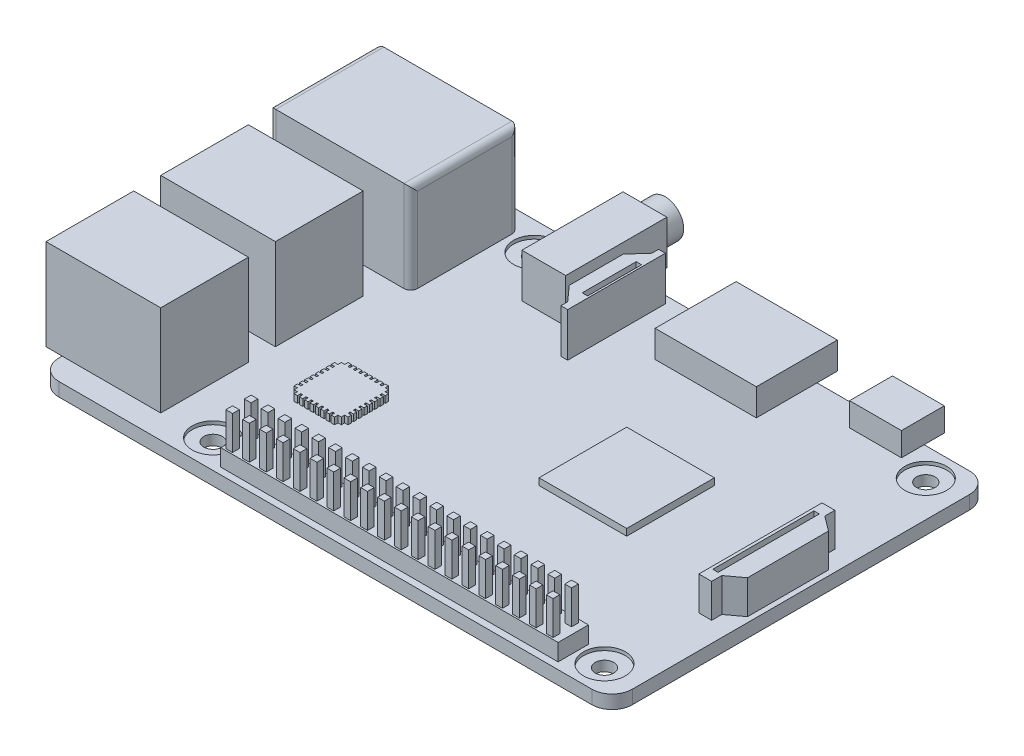
from build123d import *

# Parameters (mm, degrees)
SKETCH3_W            = 85
SKETCH3_H            = 56
BOSS_EXTRUDE1_DEPTH  = 2
FILLET1_R            = 3
SKETCH4_R            = 3.1
CUT_EXTRUDE1_DEPTH   = 0.5
SKETCH5_R            = 1.375
CUT_EXTRUDE2_DEPTH   = 51.933780539
SKETCH7_W            = 21
SKETCH7_H            = 16
BOSS_EXTRUDE2_DEPTH  = 13.5
FILLET2_R            = 1
CUT_EXTRUDE4_DEPTH   = 13.5
SKETCH9_W            = 17
SKETCH9_H            = 13
BOSS_EXTRUDE3_DEPTH  = 13.5
SKETCH10_W           = 10.6
SKETCH10_H           = 5
CUT_EXTRUDE5_DEPTH   = 13.5
SKETCH11_W           = 9.4
SKETCH11_H           = 0.8
BOSS_EXTRUDE4_DEPTH  = 13.5
LPATTERN2_COUNT      = 2
LPATTERN2_PITCH      = 17
SKETCH15_W           = 10.6
SKETCH15_H           = 5
CUT_EXTRUDE6_DEPTH   = 13.5
SKETCH16_W           = 9.4
SKETCH16_H           = 0.8
BOSS_EXTRUDE5_DEPTH  = 13.5
SKETCH18_W           = 50
SKETCH18_H           = 4.5
BOSS_EXTRUDE6_DEPTH  = 2.5
SKETCH19_W           = 1
SKETCH19_H           = 1
CUT_EXTRUDE7_DEPTH   = 2.5
LPATTERN4_COUNT      = 2
LPATTERN4_PITCH      = 2.75
SKETCH22_W           = 1
SKETCH22_H           = 1
BOSS_EXTRUDE7_DEPTH  = 7.5
LPATTERN5_COUNT      = 2
LPATTERN5_PITCH      = 2.75
SKETCH23_W           = 13
SKETCH23_H           = 13
BOSS_EXTRUDE8_DEPTH  = 1
SKETCH24_W           = 7
SKETCH24_H           = 7
BOSS_EXTRUDE9_DEPTH  = 1
BOSS_EXTRUDE10_DEPTH = 5
SKETCH26_W           = 0.8
SKETCH26_H           = 14.989562919
CUT_EXTRUDE8_DEPTH   = 5
SKETCH27_W           = 6.5
SKETCH27_H           = 14.991590698
BOSS_EXTRUDE11_DEPTH = 6.5
SKETCH28_R           = 2.75
BOSS_EXTRUDE12_DEPTH = 3
SKETCH29_R           = 1.5
CUT_EXTRUDE10_DEPTH  = 15
BOSS_EXTRUDE13_DEPTH = 6.5
SKETCH31_W           = 0.8
SKETCH31_H           = 8
CUT_EXTRUDE11_DEPTH  = 6.5
SKETCH32_W           = 15
SKETCH32_H           = 12
BOSS_EXTRUDE14_DEPTH = 4
CUT_EXTRUDE13_DEPTH  = 11
SKETCH35_W           = 12.2
SKETCH35_H           = 0.7
BOSS_EXTRUDE15_DEPTH = 11
SKETCH36_W           = 7.677483564
SKETCH36_H           = 6.353779502
BOSS_EXTRUDE16_DEPTH = 3.5
CUT_EXTRUDE14_DEPTH  = 6
SKETCH38_W           = 4.770116418
SKETCH38_H           = 0.51932676
BOSS_EXTRUDE17_DEPTH = 6
SKETCH39_W           = 0.5
SKETCH39_H           = 0.5
BOSS_EXTRUDE18_DEPTH = 1


with BuildPart() as part:
    # Sketch3 → Boss-Extrude1 (new body)
    with BuildSketch(Plane(origin=(0, 0, 0), x_dir=(1, 0, 0), z_dir=(0, 1, 0))):
        Rectangle(SKETCH3_W, SKETCH3_H)
    extrude(amount=BOSS_EXTRUDE1_DEPTH)

    # Fillet1
    fillet1_edges = [part.edges().sort_by_distance(p)[0] for p in [
        (42.5, 1, 28),
        (-42.5, 1, 28),
        (-42.5, 1, -28),
        (42.5, 1, -28),
    ]]
    fillet(fillet1_edges, radius=FILLET1_R)

    # Sketch4 → Cut-Extrude1 (cut)
    with BuildSketch(Plane(origin=(0, 2, 0), x_dir=(1, 0, 0), z_dir=(0, 1, 0))):
        with Locations(Location((37.182867936, -23.81231611, 0), (0, 0, 270))):
            Circle(SKETCH4_R)
        with Locations(Location((-20.817132064, -23.81231611, 0), (0, 0, 270))):
            Circle(SKETCH4_R)
        with Locations(Location((-20.817132064, 23.81231611, 0), (0, 0, 90))):
            Circle(SKETCH4_R)
        with Locations(Location((37.182867936, 23.81231611, 0), (0, 0, 90))):
            Circle(SKETCH4_R)
    extrude(amount=-CUT_EXTRUDE1_DEPTH, mode=Mode.SUBTRACT)

    # Sketch5 → Cut-Extrude2 (cut, through all)
    with BuildSketch(Plane(origin=(0, 2, 0), x_dir=(1, 0, 0), z_dir=(0, 1, 0))):
        with Locations(Location((37.182867936, 23.81231611, 0), (0, 0, 270))):
            Circle(SKETCH5_R)
        with Locations(Location((-20.817132064, 23.81231611, 0), (0, 0, 270))):
            Circle(SKETCH5_R)
        with Locations(Location((37.182867936, -23.81231611, 0), (0, 0, 270))):
            Circle(SKETCH5_R)
        with Locations(Location((-20.817132064, -23.81231611, 0), (0, 0, 270))):
            Circle(SKETCH5_R)
    extrude(amount=-CUT_EXTRUDE2_DEPTH, mode=Mode.SUBTRACT)

    # Sketch7 → Boss-Extrude2 (add)
    with BuildSketch(Plane(origin=(0, 2, 0), x_dir=(1, 0, 0), z_dir=(0, 1, 0))):
        with Locations((-35.334206701, 17.5)):
            Rectangle(SKETCH7_W, SKETCH7_H)
    extrude(amount=BOSS_EXTRUDE2_DEPTH)

    # Fillet2
    fillet2_edges = [part.edges().sort_by_distance(p)[0] for p in [
        (-45.834206701, 8.75, -25.5),
        (-45.834206701, 8.75, -9.5),
        (-24.834206701, 8.75, -9.5),
        (-24.834206701, 8.75, -25.5),
        (-45.834206701, 15.5, -17.5),
        (-24.834206701, 15.5, -17.5),
    ]]
    fillet(fillet2_edges, radius=FILLET2_R)

    # Sketch8 → Cut-Extrude4 (cut)
    with BuildSketch(Plane.ZY.offset(45.834206701)):
        Polygon((-19.75, 2.5), (-15.25, 2.5), (-15.25, 4), (-13.25, 4), (-13.25, 5.5), (-11.25, 5.5), (-11.25, 13), (-23.75, 13), (-23.75, 5.5), (-21.75, 5.5), (-21.75, 4), (-19.75, 4), align=None)
    extrude(amount=-CUT_EXTRUDE4_DEPTH, mode=Mode.SUBTRACT)

    # Sketch9 → Boss-Extrude3 (add)
    with BuildSketch(Plane(origin=(0, 2, 0), x_dir=(1, 0, 0), z_dir=(0, 1, 0))):
        with Locations((-36.39606869, -1)):
            Rectangle(SKETCH9_W, SKETCH9_H)
    boss_extrude3 = extrude(amount=BOSS_EXTRUDE3_DEPTH)

    # Sketch10 → Cut-Extrude5 (cut)
    with BuildSketch(Plane.ZY.offset(44.89606869)):
        with Locations((1, 11.794774308)):
            Rectangle(SKETCH10_W, SKETCH10_H)
        with Locations((0.90813073, 5.454122817)):
            Rectangle(SKETCH10_W, SKETCH10_H)
    extrude(amount=-CUT_EXTRUDE5_DEPTH, mode=Mode.SUBTRACT)

    # Sketch11 → Boss-Extrude4 (add)
    with BuildSketch(Plane.ZY.offset(31.39606869)):
        with Locations((1, 13.144774308)):
            Rectangle(SKETCH11_W, SKETCH11_H)
        with Locations((0.90813073, 6.804122817)):
            Rectangle(SKETCH11_W, SKETCH11_H)
    boss_extrude4 = extrude(amount=BOSS_EXTRUDE4_DEPTH)

    # LPattern2: Boss-Extrude3, Boss-Extrude4 ×2
    with Locations(*[(0, 0, i * LPATTERN2_PITCH) for i in range(1, LPATTERN2_COUNT)]):
        add(boss_extrude3)
        add(boss_extrude4)

    # Sketch15 → Cut-Extrude6 (cut)
    with BuildSketch(Plane.ZY.offset(44.89606869)):
        with Locations((18, 11.79)):
            Rectangle(SKETCH15_W, SKETCH15_H)
        with Locations((18, 5.312548637)):
            Rectangle(SKETCH15_W, SKETCH15_H)
    extrude(amount=-CUT_EXTRUDE6_DEPTH, mode=Mode.SUBTRACT)

    # Sketch16 → Boss-Extrude5 (add)
    with BuildSketch(Plane.ZY.offset(31.39606869)):
        with Locations((18, 13.14)):
            Rectangle(SKETCH16_W, SKETCH16_H)
        with Locations((18, 6.662548637)):
            Rectangle(SKETCH16_W, SKETCH16_H)
    extrude(amount=BOSS_EXTRUDE5_DEPTH)

    # Sketch18 → Boss-Extrude6 (add)
    with BuildSketch(Plane(origin=(0, 2, 0), x_dir=(1, 0, 0), z_dir=(0, 1, 0))):
        with Locations((8.5, -24.75)):
            Rectangle(SKETCH18_W, SKETCH18_H)
    extrude(amount=BOSS_EXTRUDE6_DEPTH)

    # Sketch19 → Cut-Extrude7 (cut)
    with BuildSketch(Plane(origin=(0, 4.5, 0), x_dir=(1, 0, 0), z_dir=(0, 1, 0))):
        with Locations((-15.5, -26.25)):
            Rectangle(SKETCH19_W, SKETCH19_H)
        with Locations((-13, -26.25)):
            Rectangle(SKETCH19_W, SKETCH19_H)
        with Locations((-10.5, -26.25)):
            Rectangle(SKETCH19_W, SKETCH19_H)
        with Locations((32, -26.25)):
            Rectangle(SKETCH19_W, SKETCH19_H)
        with Locations((29.5, -26.25)):
            Rectangle(SKETCH19_W, SKETCH19_H)
        with Locations((27, -26.25)):
            Rectangle(SKETCH19_W, SKETCH19_H)
        with Locations((17, -26.25)):
            Rectangle(SKETCH19_W, SKETCH19_H)
        with Locations((14.5, -26.25)):
            Rectangle(SKETCH19_W, SKETCH19_H)
        with Locations((-8, -26.25)):
            Rectangle(SKETCH19_W, SKETCH19_H)
        with Locations((-0.5, -26.25)):
            Rectangle(SKETCH19_W, SKETCH19_H)
        with Locations((7, -26.25)):
            Rectangle(SKETCH19_W, SKETCH19_H)
        with Locations((19.5, -26.25)):
            Rectangle(SKETCH19_W, SKETCH19_H)
        with Locations((24.5, -26.25)):
            Rectangle(SKETCH19_W, SKETCH19_H)
        with Locations((22, -26.25)):
            Rectangle(SKETCH19_W, SKETCH19_H)
        with Locations((12, -26.25)):
            Rectangle(SKETCH19_W, SKETCH19_H)
        with Locations((9.5, -26.25)):
            Rectangle(SKETCH19_W, SKETCH19_H)
        with Locations((4.5, -26.25)):
            Rectangle(SKETCH19_W, SKETCH19_H)
        with Locations((2, -26.25)):
            Rectangle(SKETCH19_W, SKETCH19_H)
        with Locations((-5.5, -26.25)):
            Rectangle(SKETCH19_W, SKETCH19_H)
        with Locations((-3, -26.25)):
            Rectangle(SKETCH19_W, SKETCH19_H)
    cut_extrude7 = extrude(amount=-CUT_EXTRUDE7_DEPTH, mode=Mode.SUBTRACT)

    # LPattern4: Cut-Extrude7 ×2
    with Locations(*[(0, 0, -i * LPATTERN4_PITCH) for i in range(1, LPATTERN4_COUNT)]):
        add(cut_extrude7, mode=Mode.SUBTRACT)

    # Sketch22 → Boss-Extrude7 (add)
    with BuildSketch(Plane(origin=(0, 2, 0), x_dir=(1, 0, 0), z_dir=(0, 1, 0))):
        with Locations((-13, -26.25)):
            Rectangle(SKETCH22_W, SKETCH22_H)
        with Locations((-15.5, -26.25)):
            Rectangle(SKETCH22_W, SKETCH22_H)
        with Locations((-10.5, -26.25)):
            Rectangle(SKETCH22_W, SKETCH22_H)
        with Locations((-8, -26.25)):
            Rectangle(SKETCH22_W, SKETCH22_H)
        with Locations((-5.5, -26.25)):
            Rectangle(SKETCH22_W, SKETCH22_H)
        with Locations((-3, -26.25)):
            Rectangle(SKETCH22_W, SKETCH22_H)
        with Locations((-0.5, -26.25)):
            Rectangle(SKETCH22_W, SKETCH22_H)
        with Locations((2, -26.25)):
            Rectangle(SKETCH22_W, SKETCH22_H)
        with Locations((4.5, -26.25)):
            Rectangle(SKETCH22_W, SKETCH22_H)
        with Locations((7, -26.25)):
            Rectangle(SKETCH22_W, SKETCH22_H)
        with Locations((9.5, -26.25)):
            Rectangle(SKETCH22_W, SKETCH22_H)
        with Locations((12, -26.25)):
            Rectangle(SKETCH22_W, SKETCH22_H)
        with Locations((14.5, -26.25)):
            Rectangle(SKETCH22_W, SKETCH22_H)
        with Locations((17, -26.25)):
            Rectangle(SKETCH22_W, SKETCH22_H)
        with Locations((19.5, -26.25)):
            Rectangle(SKETCH22_W, SKETCH22_H)
        with Locations((22, -26.25)):
            Rectangle(SKETCH22_W, SKETCH22_H)
        with Locations((24.5, -26.25)):
            Rectangle(SKETCH22_W, SKETCH22_H)
        with Locations((27, -26.25)):
            Rectangle(SKETCH22_W, SKETCH22_H)
        with Locations((29.5, -26.25)):
            Rectangle(SKETCH22_W, SKETCH22_H)
        with Locations((32, -26.25)):
            Rectangle(SKETCH22_W, SKETCH22_H)
    boss_extrude7 = extrude(amount=BOSS_EXTRUDE7_DEPTH)

    # LPattern5: Boss-Extrude7 ×2
    with Locations(*[(0, 0, -i * LPATTERN5_PITCH) for i in range(1, LPATTERN5_COUNT)]):
        add(boss_extrude7)

    # Sketch23 → Boss-Extrude8 (add)
    with BuildSketch(Plane(origin=(0, 2, 0), x_dir=(1, 0, 0), z_dir=(0, 1, 0))):
        with Locations((15.952010777, 0.719825592)):
            Rectangle(SKETCH23_W, SKETCH23_H)
    extrude(amount=BOSS_EXTRUDE8_DEPTH)

    # Sketch24 → Boss-Extrude9 (add)
    with BuildSketch(Plane(origin=(0, 2, 0), x_dir=(1, 0, 0), z_dir=(0, 1, 0))):
        with Locations((-16.492588854, -9.133558033)):
            Rectangle(SKETCH24_W, SKETCH24_H)
    extrude(amount=BOSS_EXTRUDE9_DEPTH)

    # Sketch25 → Boss-Extrude10 (add)
    with BuildSketch(Plane(origin=(0, 2, 0), x_dir=(1, 0, 0), z_dir=(0, 1, 0))):
        Polygon((37.644216471, 7.973337354), (39.544216471, 7.973337354), (39.544216471, 6.473337354), (41.736384171, 4.846284567), (41.736384171, -7.153715433), (39.544216471, -8.780768221), (39.544216471, -10.280768221), (37.644216471, -10.280768221), align=None)
    extrude(amount=BOSS_EXTRUDE10_DEPTH)

    # Sketch26 → Cut-Extrude8 (cut)
    with BuildSketch(Plane(origin=(0, 7, 0), x_dir=(1, 0, 0), z_dir=(0, 1, 0))):
        with Locations((38.470719512, -1.153715434)):
            Rectangle(SKETCH26_W, SKETCH26_H)
    extrude(amount=-CUT_EXTRUDE8_DEPTH, mode=Mode.SUBTRACT)

    # Sketch27 → Boss-Extrude11 (add)
    with BuildSketch(Plane(origin=(0, 2, 0), x_dir=(1, 0, 0), z_dir=(0, 1, 0))):
        with Locations((-12.278923063, 24.153255069)):
            Rectangle(SKETCH27_W, SKETCH27_H)
    extrude(amount=BOSS_EXTRUDE11_DEPTH)

    # Sketch28 → Boss-Extrude12 (add)
    with BuildSketch(Plane(origin=(0, 0, -31.649050418), x_dir=(-1, 0, 0), z_dir=(0, 0, -1))):
        with Locations((12.278923063, 5.25)):
            Circle(SKETCH28_R)
    extrude(amount=BOSS_EXTRUDE12_DEPTH)

    # Sketch29 → Cut-Extrude10 (cut)
    with BuildSketch(Plane(origin=(0, 0, -34.649050418), x_dir=(-1, 0, 0), z_dir=(0, 0, -1))):
        with Locations((12.278923063, 5.25)):
            Circle(SKETCH29_R)
    extrude(amount=-CUT_EXTRUDE10_DEPTH, mode=Mode.SUBTRACT)

    # Sketch30 → Boss-Extrude13 (add)
    with BuildSketch(Plane(origin=(0, 2, 0), x_dir=(1, 0, 0), z_dir=(0, 1, 0))):
        Polygon((-7.508608082, 15.664652556), (-7.508608082, 23.664652556), (-5.508608082, 25.900720534), (-5.508608082, 26.900720534), (-4.508608082, 26.900720534), (-4.508608082, 12.428584579), (-5.508608082, 12.428584579), (-5.508608082, 13.428584579), align=None)
    extrude(amount=BOSS_EXTRUDE13_DEPTH)

    # Sketch31 → Cut-Extrude11 (cut)
    with BuildSketch(Plane(origin=(0, 8.5, 0), x_dir=(1, 0, 0), z_dir=(0, 1, 0))):
        with Locations((-5.186262645, 19.664652556)):
            Rectangle(SKETCH31_W, SKETCH31_H)
    extrude(amount=-CUT_EXTRUDE11_DEPTH, mode=Mode.SUBTRACT)

    # Sketch32 → Boss-Extrude14 (add)
    with BuildSketch(Plane(origin=(0, 2, 0), x_dir=(1, 0, 0), z_dir=(0, 1, 0))):
        with Locations((9.373228364, 25.009450869)):
            Rectangle(SKETCH32_W, SKETCH32_H)
    extrude(amount=BOSS_EXTRUDE14_DEPTH)

    # Sketch34 → Cut-Extrude13 (cut)
    with BuildSketch(Plane(origin=(0, 0, -31.009450869), x_dir=(-1, 0, 0), z_dir=(0, 0, -1))):
        Polygon((-15.873228364, 5.433551818), (-2.873228364, 5.433551818), (-2.873228364, 2.933551818), (-4.173228364, 2.933551818), (-4.892393742, 2.226445036), (-14.192393742, 2.226445036), (-14.573228364, 2.933551818), (-15.873228364, 2.933551818), align=None)
    extrude(amount=-CUT_EXTRUDE13_DEPTH, mode=Mode.SUBTRACT)

    # Sketch35 → Boss-Extrude15 (add)
    with BuildSketch(Plane(origin=(0, 0, -20.009450869), x_dir=(-1, 0, 0), z_dir=(0, 0, -1))):
        with Locations((-9.373228364, 4.383551818)):
            Rectangle(SKETCH35_W, SKETCH35_H)
    extrude(amount=BOSS_EXTRUDE15_DEPTH)

    # Sketch36 → Boss-Extrude16 (add)
    with BuildSketch(Plane(origin=(0, 2, 0), x_dir=(1, 0, 0), z_dir=(0, 1, 0))):
        with Locations((28.9104605, 27.813050371)):
            Rectangle(SKETCH36_W, SKETCH36_H)
    extrude(amount=BOSS_EXTRUDE16_DEPTH)

    # Sketch37 → Cut-Extrude14 (cut)
    with BuildSketch(Plane(origin=(0, 0, -30.989940122), x_dir=(-1, 0, 0), z_dir=(0, 0, -1))):
        Polygon((-26.525402291, 5), (-31.295518709, 5), (-32.248534172, 4.046984537), (-31.201549635, 3), (-26.619371365, 3), (-25.572386828, 4.046984537), align=None)
    extrude(amount=-CUT_EXTRUDE14_DEPTH, mode=Mode.SUBTRACT)

    # Sketch38 → Boss-Extrude17 (add)
    with BuildSketch(Plane(origin=(0, 0, -24.989940122), x_dir=(-1, 0, 0), z_dir=(0, 0, -1))):
        with Locations((-28.9104605, 4.373596768)):
            Rectangle(SKETCH38_W, SKETCH38_H)
    extrude(amount=BOSS_EXTRUDE17_DEPTH)

    # Sketch39 → Boss-Extrude18 (add)
    with BuildSketch(Plane(origin=(0, 2, 0), x_dir=(1, 0, 0), z_dir=(0, 1, 0))):
        with Locations((-19.242588854, -5.383558033)):
            Rectangle(SKETCH39_W, SKETCH39_H)
        with Locations((-18.456874568, -5.383558033)):
            Rectangle(SKETCH39_W, SKETCH39_H)
        with Locations((-17.671160283, -5.383558033)):
            Rectangle(SKETCH39_W, SKETCH39_H)
        with Locations((-16.885445997, -5.383558033)):
            Rectangle(SKETCH39_W, SKETCH39_H)
        with Locations((-16.099731711, -5.383558033)):
            Rectangle(SKETCH39_W, SKETCH39_H)
        with Locations((-15.314017425, -5.383558033)):
            Rectangle(SKETCH39_W, SKETCH39_H)
        with Locations((-14.52830314, -5.383558033)):
            Rectangle(SKETCH39_W, SKETCH39_H)
        with Locations((-13.742588854, -5.383558033)):
            Rectangle(SKETCH39_W, SKETCH39_H)
        with Locations((-14.52830314, -12.883558033)):
            Rectangle(SKETCH39_W, SKETCH39_H)
        with Locations((-15.314017425, -12.883558033)):
            Rectangle(SKETCH39_W, SKETCH39_H)
        with Locations((-16.885445997, -12.883558033)):
            Rectangle(SKETCH39_W, SKETCH39_H)
        with Locations((-16.099731711, -12.883558033)):
            Rectangle(SKETCH39_W, SKETCH39_H)
        with Locations((-17.671160283, -12.883558033)):
            Rectangle(SKETCH39_W, SKETCH39_H)
        with Locations((-18.456874568, -12.883558033)):
            Rectangle(SKETCH39_W, SKETCH39_H)
        with Locations((-19.242588854, -12.883558033)):
            Rectangle(SKETCH39_W, SKETCH39_H)
        with Locations((-13.742588854, -12.883558033)):
            Rectangle(SKETCH39_W, SKETCH39_H)
        with Locations((-20.242588854, -6.383558033)):
            Rectangle(SKETCH39_W, SKETCH39_H)
        with Locations((-20.242588854, -7.169272319)):
            Rectangle(SKETCH39_W, SKETCH39_H)
        with Locations((-20.242588854, -7.954986605)):
            Rectangle(SKETCH39_W, SKETCH39_H)
        with Locations((-20.242588854, -8.74070089)):
            Rectangle(SKETCH39_W, SKETCH39_H)
        with Locations((-20.242588854, -9.526415176)):
            Rectangle(SKETCH39_W, SKETCH39_H)
        with Locations((-20.242588854, -10.312129462)):
            Rectangle(SKETCH39_W, SKETCH39_H)
        with Locations((-20.242588854, -11.097843748)):
            Rectangle(SKETCH39_W, SKETCH39_H)
        with Locations((-20.242588854, -11.883558033)):
            Rectangle(SKETCH39_W, SKETCH39_H)
        with Locations((-12.742588854, -6.383558033)):
            Rectangle(SKETCH39_W, SKETCH39_H)
        with Locations((-12.742588854, -7.169272319)):
            Rectangle(SKETCH39_W, SKETCH39_H)
        with Locations((-12.742588854, -7.954986605)):
            Rectangle(SKETCH39_W, SKETCH39_H)
        with Locations((-12.742588854, -8.74070089)):
            Rectangle(SKETCH39_W, SKETCH39_H)
        with Locations((-12.742588854, -11.883558033)):
            Rectangle(SKETCH39_W, SKETCH39_H)
        with Locations((-12.742588854, -11.097843748)):
            Rectangle(SKETCH39_W, SKETCH39_H)
        with Locations((-12.742588854, -10.312129462)):
            Rectangle(SKETCH39_W, SKETCH39_H)
        with Locations((-12.742588854, -9.526415176)):
            Rectangle(SKETCH39_W, SKETCH39_H)
    extrude(amount=BOSS_EXTRUDE18_DEPTH)


solid = part.part
